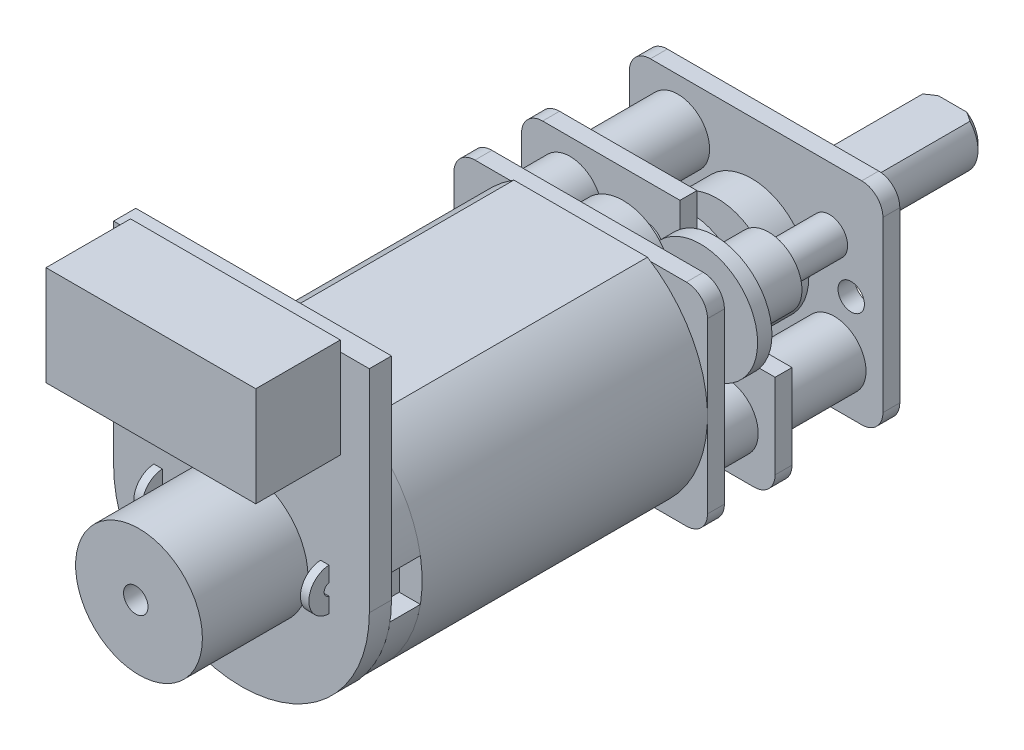
from build123d import *

# Parameters (mm, degrees)
BOSS_EXTRU_1_DEPTH                = 13.5
BOSS_EXTRU_2_DEPTH                = 1.5
ESQUISSE3_R                       = 2.5
ESQUISSE3_R_2                     = 1.25
BOSS_EXTRU_3_DEPTH                = 1.2
ESQUISSE4_W                       = 0.4
ESQUISSE4_H                       = 2
BOSS_EXTRU_4_DEPTH                = 2
ESQUISSE5_R                       = 0.277359655
ENL_V_MAT_EXTRU_1_DEPTH           = 0.4
BOSS_EXTRU_5_DEPTH                = 0.8
R_P_TITION_LIN_AIRE1_COUNT        = 2
R_P_TITION_LIN_AIRE1_PITCH        = 3.2
R_P_TITION_LIN_AIRE2_COUNT        = 2
R_P_TITION_LIN_AIRE2_PITCH        = 8.3
BOSS_EXTRU_6_REACH                = 29.262
ESQUISSE7_R                       = 1.5
ENL_V_MAT_EXTRU_2_DEPTH           = 0.8
ESQUISSE9_R                       = 2
BOSS_EXTRU_7_DEPTH                = 0.5
ESQUISSE13_W                      = 0.625
ESQUISSE13_H                      = 0.8
TROU_TARAUD_M1_6X0_351_AT_2_COUNT = 2
TROU_TARAUD_M1_6X0_351_AT_2_PITCH = 9
ESQUISSE17_R                      = 1.5
BOSS_EXTRU_8_DEPTH                = 8
CHANFREIN1_SIZE                   = 0.3
ENL_V_MAT_EXTRU_3_DEPTH           = 7.5
ENL_V_MAT_EXTRU_4_DEPTH           = 0.8
BOSS_EXTRU_9_DEPTH                = 1.05
ESQUISSE27_R                      = 3
ESQUISSE27_R_2                    = 0.578259873
BOSS_EXTRU_10_DEPTH               = 5
ESQUISSE28_W                      = 9.924916109
ESQUISSE28_H                      = 4.716094888
BOSS_EXTRU_11_DEPTH               = 4


# Read off the part's stored shape, not the designer's step: Fraisage pour vis à tête fraisée M1.61
with BuildPart() as part:
    # Esquisse1 → Boss.-Extru.1 (new body)
    with BuildSketch(Plane.XY):
        with BuildLine():
            Line((3.160696126, 5.1), (-3.160696126, 5.1))
            ThreePointArc((-3.160696126, 5.1), (-6, 0), (-3.160696126, -5.1))
            Line((-3.160696126, -5.1), (3.160696126, -5.1))
            Line((3.160696126, -5.1), (3.160696126, 5.1))
        make_face()
        with BuildLine():
            ThreePointArc((6, 0), (5.242336156, 2.918546149), (3.160696126, 5.1))
            Line((3.160696126, 5.1), (3.160696126, -5.1))
            ThreePointArc((3.160696126, -5.1), (5.242336156, -2.918546149), (6, 0))
        make_face()
    extrude(amount=BOSS_EXTRU_1_DEPTH)


with BuildPart() as body_2:
    # Esquisse2 → Boss.-Extru.2 (new body)
    with BuildSketch(Plane.XY.offset(13.5)):
        with BuildLine():
            Line((-4.916079783, -1), (-5.916079783, -1))
            ThreePointArc((-5.916079783, -1), (-4.979906146, -3.346720002), (-3.160696126, -5.1))
            Line((-3.160696126, -5.1), (3.160696126, -5.1))
            ThreePointArc((3.160696126, -5.1), (4.979906146, -3.346720002), (5.916079783, -1))
            Line((5.916079783, -1), (4.916079783, -1))
            Line((4.916079783, -1), (4.916079783, 1))
            Line((4.916079783, 1), (5.916079783, 1))
            ThreePointArc((5.916079783, 1), (4.979906146, 3.346720002), (3.160696126, 5.1))
            Line((3.160696126, 5.1), (-3.160696126, 5.1))
            ThreePointArc((-3.160696126, 5.1), (-4.979906146, 3.346720002), (-5.916079783, 1))
            Line((-5.916079783, 1), (-4.916079783, 1))
            Line((-4.916079783, 1), (-4.916079783, -1))
        make_face()
    extrude(amount=BOSS_EXTRU_2_DEPTH)

    # Esquisse3 → Boss.-Extru.3 (add)
    with BuildSketch(Plane.XY.offset(15)):
        Circle(ESQUISSE3_R)
        Circle(ESQUISSE3_R_2, mode=Mode.SUBTRACT)
    extrude(amount=BOSS_EXTRU_3_DEPTH)

    # Esquisse4 → Boss.-Extru.4 (add)
    with BuildSketch(Plane.XY.offset(15)):
        with Locations((-3.940894392, 0)):
            Rectangle(ESQUISSE4_W, ESQUISSE4_H)
    boss_extru_4 = extrude(amount=BOSS_EXTRU_4_DEPTH)

    # Esquisse5 → Enlèv. mat.-Extru.1 (cut)
    with BuildSketch(Plane.ZY.offset(4.140894392)):
        with BuildLine():
            Line((17, 1), (16, 1))
            ThreePointArc((16, 1), (16.707106781, 0.707106781), (17, 0))
            Line((17, 0), (17, 1))
        make_face()
        with BuildLine():
            Line((17, -1), (17, 0))
            ThreePointArc((17, 0), (16.707106781, -0.707106781), (16, -1))
            Line((16, -1), (17, -1))
        make_face()
        with Locations((16, 0)):
            Circle(ESQUISSE5_R)
    enl_v_mat_extru_1 = extrude(amount=-ENL_V_MAT_EXTRU_1_DEPTH, mode=Mode.SUBTRACT)

    # Symétrie1: Boss.-Extru.4, Enlèv. mat.-Extru.1 across plane
    add(boss_extru_4.mirror(Plane(origin=(0, 0, 0), x_dir=(0, 0, 1), z_dir=(1, 0, 0))))
    add(enl_v_mat_extru_1.mirror(Plane(origin=(0, 0, 0), x_dir=(0, 0, 1), z_dir=(1, 0, 0))), mode=Mode.SUBTRACT)

    # Esquisse26 → Boss.-Extru.9 (add)
    with BuildSketch(Plane.XY.offset(15)):
        with BuildLine():
            Line((-6.05, 0), (-6.05, 10))
            Line((-6.05, 10), (6.05, 10))
            Line((6.05, 10), (6.05, 0))
            ThreePointArc((6.05, 0), (0, -6.05), (-6.05, 0))
        make_face()
    extrude(amount=BOSS_EXTRU_9_DEPTH)

    # Esquisse27 → Boss.-Extru.10 (add)
    with BuildSketch(Plane.XY.offset(16.05)):
        with Locations((0.151842108, 0)):
            Circle(ESQUISSE27_R)
        Circle(ESQUISSE27_R_2, mode=Mode.SUBTRACT)
    extrude(amount=BOSS_EXTRU_10_DEPTH)

    # Esquisse28 → Boss.-Extru.11 (add)
    with BuildSketch(Plane.XY.offset(16.05)):
        with Locations((-0.285781073, 8.134276785)):
            Rectangle(ESQUISSE28_W, ESQUISSE28_H)
    extrude(amount=BOSS_EXTRU_11_DEPTH)


with BuildPart() as body_3:
    # Esquisse6 → Boss.-Extru.5 (new body)
    with BuildSketch(Plane(origin=(0, 0, 0), x_dir=(-1, 0, 0), z_dir=(0, 0, -1))):
        with BuildLine():
            Line((-5, -5), (5, -5))
            ThreePointArc((5, -5), (5.707106781, -4.707106781), (6, -4))
            Line((6, -4), (6, 4))
            ThreePointArc((6, 4), (5.707106781, 4.707106781), (5, 5))
            Line((5, 5), (-5, 5))
            ThreePointArc((-5, 5), (-5.707106781, 4.707106781), (-6, 4))
            Line((-6, 4), (-6, -4))
            ThreePointArc((-6, -4), (-5.707106781, -4.707106781), (-5, -5))
        make_face()
    boss_extru_5 = extrude(amount=BOSS_EXTRU_5_DEPTH)

    # Boss.-Extru.6: up to this face of the body (flat: up to its plane)
    boss_extru_6_end = Plane(body_3.part.faces().sort_by_distance((0, 0, -0.8))[0])
    # Esquisse7 → Boss.-Extru.6 (add, up to the picked face)
    with BuildSketch(Plane(origin=(0, 0, -9.1), x_dir=(-1, 0, 0), z_dir=(0, 0, -1)), mode=Mode.PRIVATE) as boss_extru_6_sk1:
        with Locations(Location((3.7, 2.7, 0), (0, 0, 180))):
            Circle(ESQUISSE7_R)
    boss_extru_6_tool1 = split(extrude(boss_extru_6_sk1.sketch, amount=-BOSS_EXTRU_6_REACH, mode=Mode.PRIVATE), bisect_by=boss_extru_6_end, keep=Keep.BOTH, mode=Mode.PRIVATE)
    # Esquisse7 → Boss.-Extru.6 (add, up to the picked face)
    with BuildSketch(Plane(origin=(0, 0, -9.1), x_dir=(-1, 0, 0), z_dir=(0, 0, -1)), mode=Mode.PRIVATE) as boss_extru_6_sk2:
        with Locations(Location((-3.7, -2.7, 0), (0, 0, 180))):
            Circle(ESQUISSE7_R)
    boss_extru_6_tool2 = split(extrude(boss_extru_6_sk2.sketch, amount=-BOSS_EXTRU_6_REACH, mode=Mode.PRIVATE), bisect_by=boss_extru_6_end, keep=Keep.BOTH, mode=Mode.PRIVATE)


with BuildPart() as r_p_tition_lin_aire1_1:
    # Répétition linéaire1: Boss.-Extru.5 ×2
    with Locations(*[(0, 0, -i * R_P_TITION_LIN_AIRE1_PITCH) for i in range(1, R_P_TITION_LIN_AIRE1_COUNT)]):
        add(boss_extru_5)


with BuildPart() as r_p_tition_lin_aire2_1:
    # Répétition linéaire2: Boss.-Extru.5 ×2
    with Locations(*[(0, 0, -i * R_P_TITION_LIN_AIRE2_PITCH) for i in range(1, R_P_TITION_LIN_AIRE2_COUNT)]):
        add(boss_extru_5)


with BuildPart() as body_3_1:
    add(body_3.part)

    add(r_p_tition_lin_aire1_1.part)  # Boss.-Extru.6 merges Répétition linéaire1_1

    add(r_p_tition_lin_aire2_1.part)  # Boss.-Extru.6 merges Répétition linéaire2_1
    add(boss_extru_6_tool1.solids().sort_by(Axis((-3.7, 2.7, -9.1), (0, 0, 1)))[0])
    add(boss_extru_6_tool2.solids().sort_by(Axis((3.7, -2.7, -9.1), (0, 0, 1)))[0])

    # Esquisse8 → Enlèv. mat.-Extru.2 (cut)
    with BuildSketch(Plane(origin=(0, 0, -4), x_dir=(-1, 0, 0), z_dir=(0, 0, -1))):
        with BuildLine():
            Line((-1.5, 5.1), (-1.5, 1.5))
            ThreePointArc((-1.5, 1.5), (-1.939339828, 0.439339828), (-3, 0))
            Line((-3, 0), (-6, 0))
            Line((-6, 0), (-6, 5.1))
            Line((-6, 5.1), (-1.5, 5.1))
        make_face()
    extrude(amount=-ENL_V_MAT_EXTRU_2_DEPTH, mode=Mode.SUBTRACT)

    # Esquisse9 → Boss.-Extru.7 (add)
    with BuildSketch(Plane(origin=(0, 0, -9.1), x_dir=(-1, 0, 0), z_dir=(0, 0, -1))):
        Circle(ESQUISSE9_R)
    extrude(amount=BOSS_EXTRU_7_DEPTH)

    # Esquisse13 → Trou taraudé M1.6x0.351 (revolve, cut)
    with BuildSketch(Plane(origin=(4.5, 0, -9.1), x_dir=(0, 1, 0), z_dir=(1, 0, 0))):
        with Locations((0.3125, 0.4)):
            Rectangle(ESQUISSE13_W, ESQUISSE13_H)
    trou_taraud_m1_6x0_351 = revolve(axis=Axis((4.5, 0, -15.45), (0, 0, 1)), mode=Mode.SUBTRACT)

    # Trou taraudé M1.6x0.351 at 2: Trou taraudé M1.6x0.351 ×2
    with Locations(*[(-i * TROU_TARAUD_M1_6X0_351_AT_2_PITCH, 0, 0) for i in range(1, TROU_TARAUD_M1_6X0_351_AT_2_COUNT)]):
        add(trou_taraud_m1_6x0_351, mode=Mode.SUBTRACT)

    # Fraisage pour vis à tête fraisée M1.61 o → Fraisage pour vis à tête fraisée M1.61 (revolve, cut)
    with BuildSketch(Plane(origin=(-3.7, 2.7, 0), x_dir=(1, 0, 0), z_dir=(0, -1, 0))):
        Polygon((0.9, -4), (0, -4), (0, -9.1), (1.8, -9.1), (0.9, -8.2), align=None)
    revolve(axis=Axis((-3.7, 2.7, 0), (0, 0, 1)), mode=Mode.SUBTRACT)

    # Fraisage pour vis _ t_te frais_e M1. 2 → Fraisage pour vis _ t_te frais_e M1.61 2 (revolve, cut)
    with BuildSketch(Plane(origin=(3.7, -2.7, 0), x_dir=(1, 0, 0), z_dir=(0, -1, 0))):
        Polygon((0.9, -4), (0, -4), (0, -9.1), (1.8, -9.1), (0.9, -8.2), align=None)
    revolve(axis=Axis((3.7, -2.7, 0), (0, 0, 1)), mode=Mode.SUBTRACT)

    # Esquisse17 → Boss.-Extru.8 (add)
    with BuildSketch(Plane(origin=(0, 0, -9.6), x_dir=(-1, 0, 0), z_dir=(0, 0, -1))):
        Circle(ESQUISSE17_R)
    extrude(amount=BOSS_EXTRU_8_DEPTH)

    # Chanfrein1
    chanfrein1_edges = [body_3_1.edges().sort_by_distance(p)[0] for p in [
        (1.5, 0, -17.6),
    ]]
    chamfer(chanfrein1_edges, length=CHANFREIN1_SIZE)

    # Esquisse18 → Enlèv. mat.-Extru.3 (cut)
    with BuildSketch(Plane(origin=(0, 0, -17.6), x_dir=(-1, 0, 0), z_dir=(0, 0, -1))):
        with BuildLine():
            Line((-1.118033989, 1), (1.118033989, 1))
            ThreePointArc((1.118033989, 1), (0, 1.5), (-1.118033989, 1))
        make_face()
    extrude(amount=-ENL_V_MAT_EXTRU_3_DEPTH, mode=Mode.SUBTRACT)

    # Esquisse20 → Révolution2 (revolve)
    with BuildSketch(Plane(origin=(0, 2, 0), x_dir=(-1, 0, 0), z_dir=(0, 1, 0)), mode=Mode.PRIVATE) as r_volution2_sk:
        Polygon((-3.474579428, -0.8), (-2.617508768, -0.8), (-2.617508768, -2.196806681), (-0.774537165, -2.196806681), (-0.774537165, -2.876552377), (-1.893431831, -2.876552377), (-1.893431831, -5.414597353), (-2.617508768, -5.414597353), (-2.617508768, -8.3), (-3.474579428, -8.3), align=None)
    revolve(r_volution2_sk.sketch.rotate(Axis((3.474579428, 2, -0.8), (0, 0, -1)), 180), axis=Axis((3.474579428, 2, -0.8), (0, 0, -1)))


with BuildPart() as body_4:
    # Esquisse19 → Révolution1 (revolve)
    with BuildSketch(Plane(origin=(0, 0, 0), x_dir=(1, 0, 0), z_dir=(0, 1, 0))):
        Polygon((0, 0.8), (1.226963311, 0.8), (1.226963311, 2.036957743), (0.335913022, 2.036957743), (0.335913022, 4.207930806), (2.770785295, 4.207930806), (2.770785295, 5.16049073), (1.004185236, 5.16049073), (1.004185236, 6.457605051), (2.704247272, 6.457605051), (2.704247272, 8.089367495), (1.520080147, 8.089367495), (1.520080147, 8.3), (0, 8.3), align=None)
    revolve(axis=Axis((0, 0, 0), (0, 0, -1)))


with BuildPart() as body_5:
    # Esquisse21 → Révolution3 (revolve)
    with BuildSketch(Plane(origin=(0, -2, 0), x_dir=(-1, 0, 0), z_dir=(0, 1, 0))):
        Polygon((2.52248655, -8.3), (1.871364783, -8.3), (1.871364783, -6.457605051), (0.145478887, -6.457605051), (0.145478887, -5.280901037), (2.043772307, -5.280901037), (2.043772307, -4), (2.52248655, -4), align=None)
    revolve(axis=Axis((-2.52248655, -2, -1.56184198), (0, 0, -1)))


with BuildPart() as body_6:
    # Esquisse22 → Révolution4 (revolve)
    with BuildSketch(Plane(origin=(0, 0, 0), x_dir=(0, 0, -1), z_dir=(1, 0, 0))):
        Polygon((0.8, 2.78288325), (0.94274036, 2.78288325), (0.94274036, 4.836864208), (2.013432562, 4.836864208), (2.013432562, 3.436307107), (3.084124763, 3.436307107), (3.084124763, 2.78288325), (3.346335098, 2.78288325), (3.346335098, 2.552931448), (0.8, 2.552931448), align=None)
    revolve(axis=Axis((0, 2.552931448, -11.861833769), (0, 0, 1)))


with BuildPart() as body_7:
    # Esquisse23 → Révolution5 (revolve)
    with BuildSketch(Plane(origin=(0, 0, 0), x_dir=(-0.807790947859209, 0.5894690700594228, 0), z_dir=(0.5894690700594228, 0.807790947859209, 0)), mode=Mode.PRIVATE) as r_volution5_sk:
        Polygon((-5.480392996, -8.2), (-6.014725225, -8.734332228), (-6.014725225, -9.1), (-4.580392996, -9.1), (-4.580392996, -8.2), align=None)
    revolve(r_volution5_sk.sketch.rotate(Axis((3.7, -2.7, -4.657558661), (0, 0, -1)), 323.880659151), axis=Axis((3.7, -2.7, -4.657558661), (0, 0, -1)))


with BuildPart() as body_8:
    # Esquisse24 → Révolution6 (revolve)
    with BuildSketch(Plane(origin=(0, 0, 0), x_dir=(-0.807790947859209, 0.5894690700594228, 0), z_dir=(0.5894690700594228, 0.807790947859209, 0)), mode=Mode.PRIVATE) as r_volution6_sk:
        Polygon((4.580392996, -8.2), (3.680392996, -8.2), (3.146060768, -8.734332228), (3.146060768, -9.1), (4.580392996, -9.1), align=None)
    revolve(r_volution6_sk.sketch.rotate(Axis((-3.7, 2.7, -9.1), (0, 0, 1)), 216.119340849), axis=Axis((-3.7, 2.7, -9.1), (0, 0, 1)))


with BuildPart() as enl_v_mat_extru_4_tool:
    # Esquisse25 → Enlèv. mat.-Extru.4 (new body)
    with BuildSketch(Plane(origin=(0, 0, -9.1), x_dir=(-1, 0, 0), z_dir=(0, 0, -1))):
        Polygon((2.711166018, 2.510947404), (4.587392081, 3.175466952), (4.688833982, 2.889052596), (2.812607919, 2.224533048), align=None)
        Polygon((3.889052596, 1.711166018), (3.224533048, 3.587392081), (3.510947404, 3.688833982), (4.175466952, 1.812607919), align=None)
        Polygon((-4.366907642, -3.454166908), (-3.288477394, -1.781205859), (-3.033092358, -1.945833092), (-4.111522606, -3.618794141), align=None)
        Polygon((-4.618794141, -2.288477394), (-2.945833092, -3.366907642), (-2.781205859, -3.111522606), (-4.454166908, -2.033092358), align=None)
    extrude(amount=-ENL_V_MAT_EXTRU_4_DEPTH)


with BuildPart() as body_3_2:
    add(body_3_1.part)

    # Enlèv. mat.-Extru.4: cut by enl_v_mat_extru_4_tool
    add(enl_v_mat_extru_4_tool.part, mode=Mode.SUBTRACT)


with BuildPart() as body_7_1:
    add(body_7.part)

    # Enlèv. mat.-Extru.4: cut by enl_v_mat_extru_4_tool
    add(enl_v_mat_extru_4_tool.part, mode=Mode.SUBTRACT)


with BuildPart() as body_8_1:
    add(body_8.part)

    # Enlèv. mat.-Extru.4: cut by enl_v_mat_extru_4_tool
    add(enl_v_mat_extru_4_tool.part, mode=Mode.SUBTRACT)


solid = Compound([part.part, body_2.part, body_4.part, body_5.part, body_6.part, body_3_2.part, body_7_1.part, body_8_1.part])
